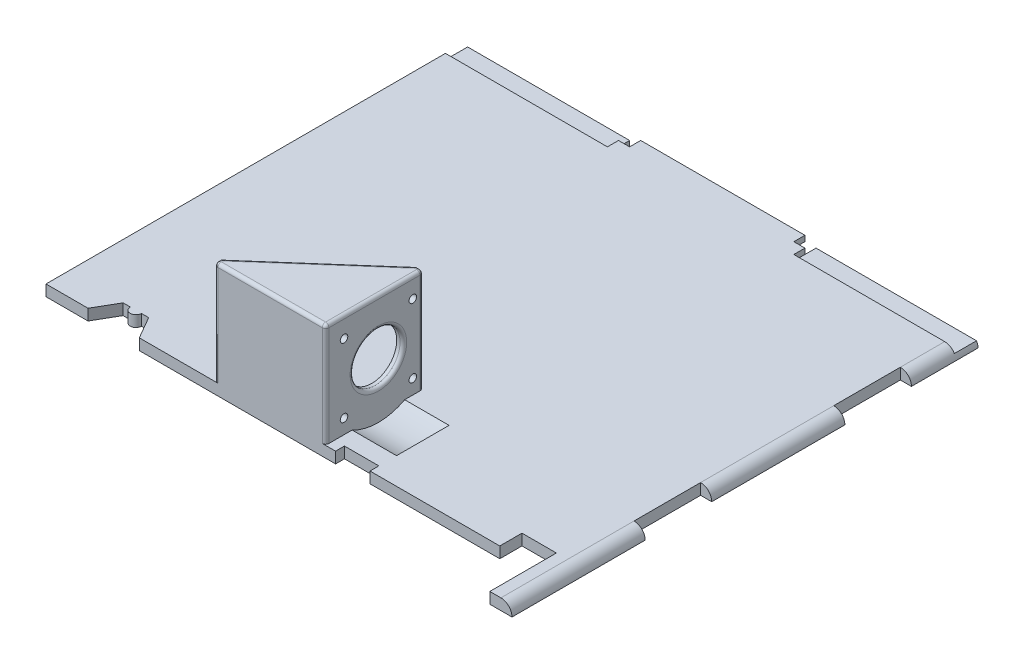
from build123d import *

# Parameters (mm, degrees)
SKETCH_1_W           = 5
SKETCH_1_H           = 60
SKETCH_1_W_2         = 30
SKETCH_1_H_2         = 5
SKETCH_1_W_3         = 15
EXTRUDE_1_DEPTH      = 5
FILLET_1_R           = 5
SKETCH_2_W           = 245
SKETCH_2_H           = 125
CUT_EXTRUDE_1_DEPTH  = 5
SKETCH_3_W           = 74
SKETCH_3_H           = 2.5
SKETCH_3_W_2         = 73
CUT_EXTRUDE_2_DEPTH  = 10
SKETCH_4_W           = 5
SKETCH_4_H           = 5
CUT_EXTRUDE_3_DEPTH  = 5
SKETCH_5_W           = 50
SKETCH_5_H           = 46.65
EXTRUDE_2_DEPTH      = 47
SKETCH_6_W           = 41.4
SKETCH_6_H           = 44.05
CUT_EXTRUDE_4_DEPTH  = 47
SKETCH_7_R           = 11.25
CUT_EXTRUDE_5_DEPTH  = 317.004529962
CUT_EXTRUDE_6_DEPTH  = 46.65
SKETCH_10_R          = 1.7
CUT_EXTRUDE_7_DEPTH  = 317.004529962
SKETCH_13_R          = 25
CUT_EXTRUDE_9_DEPTH  = 20
FILLET_11_R          = 1.497
CUT_EXTRUDE_10_DEPTH = 358.50996514
SKETCH_17_R          = 2.5
EXTRUDE_3_DEPTH      = 5


with BuildPart() as part:
    # 草圖1 → 填料-伸長1 (new body)
    with BuildSketch(Plane(origin=(0, 0, 0), x_dir=(1, 0, 0), z_dir=(0, 1, 0))):
        Polygon((198.746286718, -286.464902661), (198.746286718, -256.464902661), (183.246286718, -256.464902661), (183.246286718, -266.464902661), (124.746286718, -266.464902661), (124.746286718, -262.464902661), (109.246286718, -262.464902661), (109.246286718, -266.464902661), (-21.253713282, -266.464902661), (-21.253713282, 38.535097339), (-36.253713282, 38.535097339), (-36.253713282, 43.535097339), (203.746286718, 43.535097339), (203.746286718, -286.464902661), align=None)
        with Locations((206.246286718, -256.464902661)):
            Rectangle(SKETCH_1_W, SKETCH_1_H)
        with Locations((206.246286718, 13.535097339)):
            Rectangle(SKETCH_1_W, SKETCH_1_H)
        with Locations((188.746286718, 46.035097339)):
            Rectangle(SKETCH_1_W_2, SKETCH_1_H_2)
        with Locations((-21.253713282, 46.035097339)):
            Rectangle(SKETCH_1_W_2, SKETCH_1_H_2)
        with Locations((91.246286718, 46.035097339)):
            Rectangle(SKETCH_1_W_3, SKETCH_1_H_2)
        with Locations((76.246286718, 46.035097339)):
            Rectangle(SKETCH_1_W_3, SKETCH_1_H_2)
        with Locations((206.246286718, -166.464902661)):
            Rectangle(SKETCH_1_W, SKETCH_1_H)
        with Locations((206.246286718, -76.464902661)):
            Rectangle(SKETCH_1_W, SKETCH_1_H)
    extrude(amount=EXTRUDE_1_DEPTH)

    # 圓角1
    fillet_1_edges = [part.edges().sort_by_distance(p)[0] for p in [
        (208.746286718, 5, -13.535097339),
        (208.746286718, 5, 76.464902661),
        (208.746286718, 5, 166.464902661),
        (208.746286718, 5, 256.464902661),
    ]]
    fillet(fillet_1_edges, radius=FILLET_1_R - 0.0001)  # a hair under: the kernel refuses the full size

    # 草圖2 → 除料-伸長1 (cut)
    with BuildSketch(Plane(origin=(0, 5, 0), x_dir=(1, 0, 0), z_dir=(0, 1, 0))):
        with Locations((86.246286718, -13.964902661)):
            Rectangle(SKETCH_2_W, SKETCH_2_H)
    extrude(amount=-CUT_EXTRUDE_1_DEPTH, mode=Mode.SUBTRACT)

    # 草圖3 → 除料-伸長2 (cut)
    with BuildSketch(Plane(origin=(0, 0, 76.464902661), x_dir=(-1, 0, 0), z_dir=(0, 0, -1))):
        with Locations((-93.746286718, 1.25)):
            Rectangle(SKETCH_3_W, SKETCH_3_H)
        with Locations((-172.246286718, 3.75)):
            Rectangle(SKETCH_3_W_2, SKETCH_3_H)
        with Locations((-15.246286718, 3.75)):
            Rectangle(SKETCH_3_W_2, SKETCH_3_H)
    extrude(amount=-CUT_EXTRUDE_2_DEPTH, mode=Mode.SUBTRACT)

    # 草圖4 → 除料-伸長3 (cut)
    with BuildSketch(Plane(origin=(0, 0, 76.464902661), x_dir=(-1, 0, 0), z_dir=(0, 0, -1))):
        with Locations((-133.246286718, 2.5)):
            Rectangle(SKETCH_4_W, SKETCH_4_H)
        with Locations((-54.246286718, 2.5)):
            Rectangle(SKETCH_4_W, SKETCH_4_H)
    extrude(amount=-CUT_EXTRUDE_3_DEPTH, mode=Mode.SUBTRACT)

    # 草圖5 → 填料-伸長2 (add)
    with BuildSketch(Plane.XY.offset(266.464902661)):
        with Locations((79.746286718, 28.325)):
            Rectangle(SKETCH_5_W, SKETCH_5_H)
    extrude(amount=-EXTRUDE_2_DEPTH)

    # 草圖6 → 除料-伸長4 (cut)
    with BuildSketch(Plane.ZY.offset(-54.746286718)):
        with Locations((242.964902661, 27.025)):
            Rectangle(SKETCH_6_W, SKETCH_6_H)
    extrude(amount=-CUT_EXTRUDE_4_DEPTH, mode=Mode.SUBTRACT)

    # 草圖7 → 除料-伸長5 (cut, through all)
    with BuildSketch(Plane.ZY.offset(-101.746286718)):
        with Locations((242.664902661, 27.02)):
            Circle(SKETCH_7_R)
    extrude(amount=-CUT_EXTRUDE_5_DEPTH, mode=Mode.SUBTRACT)

    # 草圖8 → 除料-伸長6 (cut)
    with BuildSketch(Plane(origin=(0, 51.65, 0), x_dir=(1, 0, 0), z_dir=(0, 1, 0))):
        Polygon((54.746286718, -263.664902661), (101.746286718, -222.464902661), (104.746286718, -222.464902661), (104.746286718, -219.464902661), (54.746286718, -219.464902661), align=None)
    extrude(amount=-CUT_EXTRUDE_6_DEPTH, mode=Mode.SUBTRACT)

    # 草圖10 → 除料-伸長7 (cut, through all)
    with BuildSketch(Plane.ZY.offset(-101.746286718)):
        with Locations((227.164902661, 42.52)):
            Circle(SKETCH_10_R)
        with Locations((258.164902661, 42.52)):
            Circle(SKETCH_10_R)
        with Locations((258.164902661, 11.52)):
            Circle(SKETCH_10_R)
        with Locations((227.164902661, 11.52)):
            Circle(SKETCH_10_R)
    extrude(amount=-CUT_EXTRUDE_7_DEPTH, mode=Mode.SUBTRACT)

    # 草圖13 → 除料-伸長9 (cut)
    with BuildSketch(Plane(origin=(104.746286718, 0, 0), x_dir=(0, 0, -1), z_dir=(1, 0, 0))):
        with Locations((-242.664902661, 27.02)):
            Circle(SKETCH_13_R)
    extrude(amount=CUT_EXTRUDE_9_DEPTH, mode=Mode.SUBTRACT)

    # 圓角11
    fillet_11_edges = [part.edges().sort_by_distance(p)[0] for p in [
        (54.746286718, 28.325, 266.464902661),
        (79.746286718, 51.65, 266.464902661),
        (104.746286718, 28.325, 266.464902661),
        (104.746286718, 27.02, 231.414902661),
        (54.746286718, 51.65, 265.064902661),
        (104.746286718, 51.65, 244.464902661),
        (104.746286718, 28.325, 222.464902661),
        (78.246286718, 51.65, 243.064902661),
        (103.246286718, 51.65, 222.464902661),
    ]]
    fillet(fillet_11_edges, radius=FILLET_11_R)

    # 草圖14 → 除料-伸長10 (cut, through all)
    with BuildSketch(Plane(origin=(0, 5, 0), x_dir=(1, 0, 0), z_dir=(0, 1, 0))):
        Polygon((20.793292101, -266.464902661), (15.019789409, -256.464902661), (3.472784026, -256.464902661), (-2.300718666, -266.464902661), (3.472784026, -276.464902661), (15.019789409, -276.464902661), align=None)
    extrude(amount=-CUT_EXTRUDE_10_DEPTH, mode=Mode.SUBTRACT)

    # 草圖17 → 填料-伸長3 (add)
    with BuildSketch(Plane(origin=(0, 5, 0), x_dir=(1, 0, 0), z_dir=(0, 1, 0))):
        with Locations((9.246286718, -256.464902661)):
            Circle(SKETCH_17_R)
    extrude(amount=-EXTRUDE_3_DEPTH)


solid = part.part
